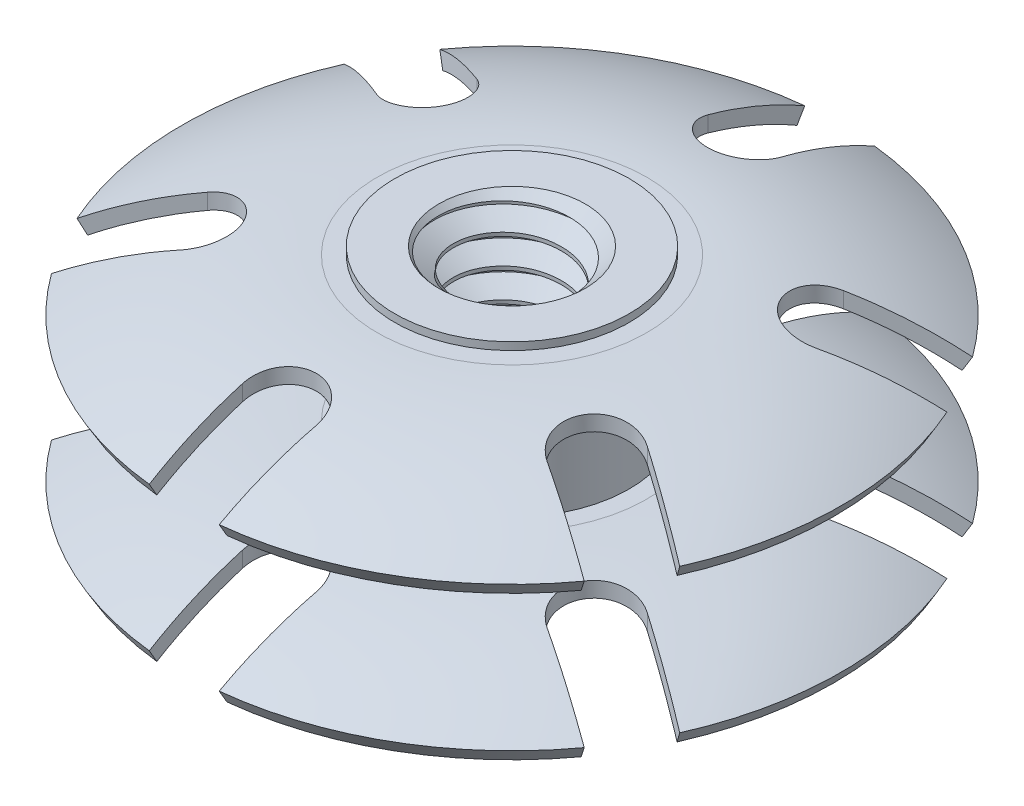
from build123d import *

# Parameters (mm, degrees)
CUT_EXTRUDE1_DEPTH  = 23.290784597
CIRPATTERN1_COUNT   = 6
SKETCH8_R           = 3.175
BOSS_EXTRUDE1_DEPTH = 7.5692
BOSS_EXTRUDE2_START = -7.5692
SKETCH9_R           = 3.175
BOSS_EXTRUDE2_DEPTH = 7.5692
CUT_SWEEP1_PITCH    = 1.27


with BuildPart() as part:
    # Sketch2 → Revolve1 (revolve)
    with BuildSketch(Plane.XY, mode=Mode.PRIVATE) as revolve1_sk:
        Polygon((-5.08, 3.7846), (-3.175, 3.7846), (-3.175, -3.7846), (-5.08, -3.7846), (-5.08, -3.4544), (-4.572, -3.4544), (-4.572, -2.794), (-5.08, -2.794), (-5.08, 2.794), (-4.572, 2.794), (-4.572, 3.4544), (-5.08, 3.4544), align=None)
    revolve(revolve1_sk.sketch.rotate(Axis((0, 0, 0), (0, 1, 0)), 270), axis=Axis((0, 0, 0), (0, 1, 0)))

    # Sketch9 → Boss-Extrude2 (add)
    with BuildSketch(Plane(origin=(0, 3.7846, 0), x_dir=(1, 0, 0), z_dir=(0, 1, 0)).offset(BOSS_EXTRUDE2_START)):
        with Locations(Location((0, 0, 0), (0, 0, 270))):
            Circle(SKETCH9_R)
    extrude(amount=BOSS_EXTRUDE2_DEPTH)


with BuildPart() as body_2:
    # Sketch5 → Revolve2 (revolve)
    with BuildSketch(Plane.XY, mode=Mode.PRIVATE) as revolve2_sk:
        with BuildLine():
            Line((-5.842, 3.4544), (-4.572, 3.4544))
            Line((-4.572, 3.4544), (-4.572, 2.794))
            Line((-4.572, 2.794), (-5.842, 2.794))
            ThreePointArc((-5.842, 2.794), (-10.042788393, 2.240955716), (-13.9573, 0.619511919))
            Line((-13.9573, 0.619511919), (-14.2875, 1.191435095))
            ThreePointArc((-14.2875, 1.191435095), (-10.213712491, 2.878853132), (-5.842, 3.4544))
        make_face()
        with BuildLine():
            Line((-5.842, -2.794), (-4.572, -2.794))
            Line((-4.572, -2.794), (-4.572, -3.4544))
            Line((-4.572, -3.4544), (-5.842, -3.4544))
            ThreePointArc((-5.842, -3.4544), (-10.042788393, -4.007444284), (-13.9573, -5.628888081))
            Line((-13.9573, -5.628888081), (-14.2875, -5.056964905))
            ThreePointArc((-14.2875, -5.056964905), (-10.213712491, -3.369546868), (-5.842, -2.794))
        make_face()
    revolve(revolve2_sk.sketch.rotate(Axis((0, 0, 0), (0, 1, 0)), 270), axis=Axis((0, 0, 0), (0, 1, 0)))

    # Sketch6 → Cut-Extrude1 (cut, through all)
    with BuildSketch(Plane(origin=(0, 3.7846, 0), x_dir=(1, 0, 0), z_dir=(0, 1, 0))):
        with BuildLine():
            Line((-1.587258216, 10.092455695), (-1.515440269, 14.206903147))
            ThreePointArc((-1.515440269, 14.206903147), (0, 14.2875), (1.515440269, 14.206903147))
            Line((1.515440269, 14.206903147), (1.587258216, 10.092455695))
            ThreePointArc((1.587258216, 10.092455695), (0, 8.47725), (-1.587258216, 10.092455695))
        make_face()
    cut_extrude1 = extrude(amount=-CUT_EXTRUDE1_DEPTH, mode=Mode.SUBTRACT)

    # CirPattern1: Cut-Extrude1 ×6 about axis
    cirpattern1_axis = Axis((0, 0, 0), (0, 1, 0))
    for i in range(1, CIRPATTERN1_COUNT):
        add(cut_extrude1.rotate(cirpattern1_axis, i * 360 / CIRPATTERN1_COUNT), mode=Mode.SUBTRACT)


with BuildPart() as body_3:
    # Sketch8 → Boss-Extrude1 (new body)
    with BuildSketch(Plane(origin=(0, 3.7846, 0), x_dir=(1, 0, 0), z_dir=(0, 1, 0))):
        with Locations(Location((0, 0, 0), (0, 0, 270))):
            Circle(SKETCH8_R)
    extrude(amount=-BOSS_EXTRUDE1_DEPTH)

    # Cut-Sweep1: arcs per turn and ends read off the stored shape
    # Cut-Sweep1: the profile of Sketch11 profile screwed along a right-hand helix through 7.900003 turns, 8 arcs to a turn; built about Z, then put on its axis
    cut_sweep1_z = Axis((0, 0, 0), (0, 0, 1))
    cut_sweep1_corners = [(3.1753, 0, -0.279226795), (3.1753, 0, -1.390823205), (2.350110803, 0, -0.9144), (2.350110803, 0, -0.75565)]
    with BuildLine(mode=Mode.PRIVATE) as cut_sweep1_profile:
        Line(cut_sweep1_corners[0], cut_sweep1_corners[1])
        Line(cut_sweep1_corners[1], cut_sweep1_corners[2])
        Line(cut_sweep1_corners[2], cut_sweep1_corners[3])
        Line(cut_sweep1_corners[3], cut_sweep1_corners[0])
    cut_sweep1_cap = Face(cut_sweep1_profile.wire())
    cut_sweep1_turn_angles = [0, 22.5, 45, 67.5, 90, 112.5, 135, 157.5, 180, 202.5, 225, 247.5, 270, 292.5, 315, 337.5, 360]
    cut_sweep1_turn_weights = [1, 0.9238795325112867, 1, 0.9238795325112867, 1, 0.9238795325112867, 1, 0.9238795325112867, 1, 0.9238795325112867, 1, 0.9238795325112867, 1, 0.9238795325112867, 1, 0.9238795325112867, 1]
    cut_sweep1_turn_rails = [Edge.make_bspline([Vector(p[0], p[1], 0).rotate(cut_sweep1_z, cut_sweep1_turn_angles[k]) / cut_sweep1_turn_weights[k] + Vector(0, 0, p[2] + CUT_SWEEP1_PITCH * cut_sweep1_turn_angles[k] / 360) for k in range(17)], [0, 0, 0, 1, 1, 2, 2, 3, 3, 4, 4, 5, 5, 6, 6, 7, 7, 8, 8, 8], 2, cut_sweep1_turn_weights) for p in cut_sweep1_corners]
    cut_sweep1_turn_sides = [Face.make_surface_from_curves(cut_sweep1_turn_rails[p[0]], cut_sweep1_turn_rails[p[1]]) for p in [(0, 1), (1, 2), (2, 3), (3, 0)]]
    cut_sweep1_last_angles = [2520, 2542.5, 2565, 2587.5, 2610, 2632.5, 2655, 2677.5, 2700, 2722.5, 2745, 2767.5, 2790, 2812.5, 2835, 2839.5005, 2844.001]
    cut_sweep1_last_weights = [1, 0.9238795325112867, 1, 0.9238795325112867, 1, 0.9238795325112867, 1, 0.9238795325112867, 1, 0.9238795325112867, 1, 0.9238795325112867, 1, 0.9238795325112867, 1, 0.9969166490103938, 1]
    cut_sweep1_last_rails = [Edge.make_bspline([Vector(p[0], p[1], 0).rotate(cut_sweep1_z, cut_sweep1_last_angles[k]) / cut_sweep1_last_weights[k] + Vector(0, 0, p[2] + CUT_SWEEP1_PITCH * cut_sweep1_last_angles[k] / 360) for k in range(17)], [0, 0, 0, 1, 1, 2, 2, 3, 3, 4, 4, 5, 5, 6, 6, 7, 7, 8, 8, 8], 2, cut_sweep1_last_weights) for p in cut_sweep1_corners]
    cut_sweep1_last_sides = [Face.make_surface_from_curves(cut_sweep1_last_rails[p[0]], cut_sweep1_last_rails[p[1]]) for p in [(0, 1), (1, 2), (2, 3), (3, 0)]]
    cut_sweep1 = Plane(origin=(0, 3.7846, 0), x_dir=(1, 0, 0), z_dir=(0, -1, 0)) * Solid(Shell([*[p.moved(Location((0, 0, CUT_SWEEP1_PITCH * i))) for i in range(7) for p in cut_sweep1_turn_sides], *cut_sweep1_last_sides, cut_sweep1_cap, cut_sweep1_cap.rotate(cut_sweep1_z, 2844.001).moved(Location((0, 0, CUT_SWEEP1_PITCH * 2844.001 / 360)))]))
    add(cut_sweep1, mode=Mode.SUBTRACT)


with BuildPart() as part_1:
    add(part.part)

    # Combine1: cut body 3
    add(body_3.part, mode=Mode.SUBTRACT)

    # Cut-Extrude2 cone 1 section (through the dimple's axis) → Cut-Extrude2 (revolve, cut)
    with BuildSketch(Plane(origin=(0, 3.7846, 0), x_dir=(0, 0, 1), z_dir=(1, 0, 0))):
        Polygon((0, 0), (3.175, 0), (0, 3.175), align=None)
    revolve(axis=Axis((0, 3.7846, 0), (0, -1, 0)), mode=Mode.SUBTRACT)

    # Cut-Extrude3 cone 1 section (through the dimple's axis) → Cut-Extrude3 (revolve, cut)
    with BuildSketch(Plane(origin=(0, -3.7846, 0), x_dir=(0, 0, -1), z_dir=(1, 0, 0))):
        Polygon((0, 0), (3.175, 0), (0, 3.175), align=None)
    revolve(axis=Axis((0, -3.7846, 0), (0, 1, 0)), mode=Mode.SUBTRACT)


solid = Compound([body_2.part, part_1.part])
